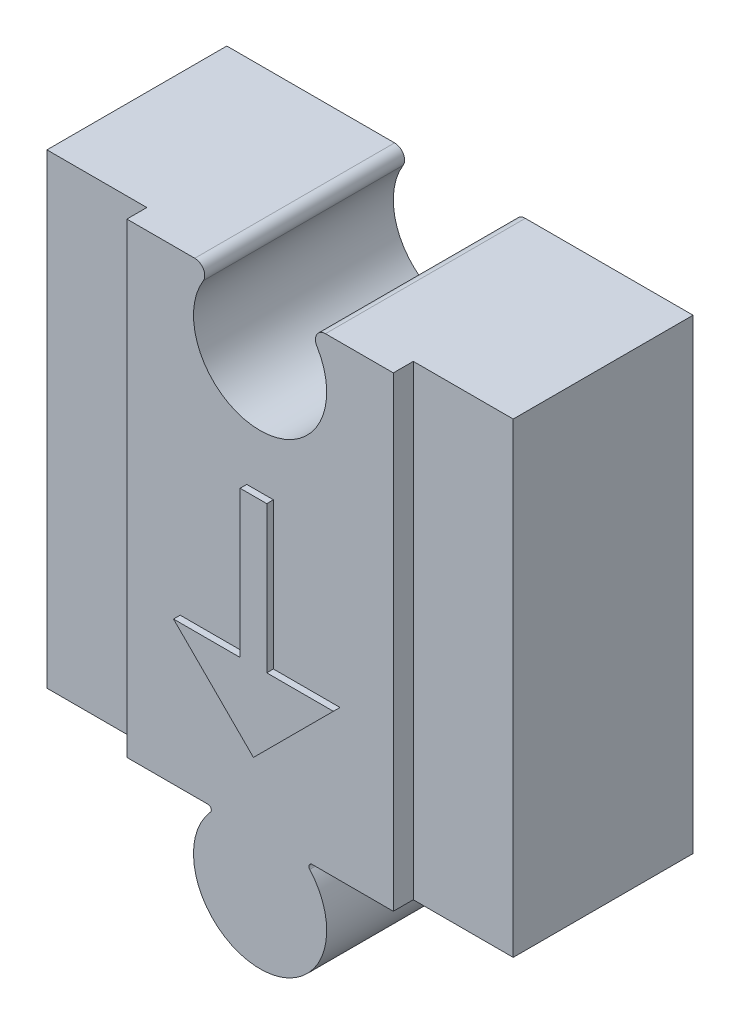
from build123d import *

# Parameters (mm, degrees)
BOSS_EXTRU_1_DEPTH           = 30
BOSS_EXTRU_2_DEPTH           = 1
ENL_V_MAT_EXTRU_2_DEPTH      = 70.865943062
ENL_V_MAT_EXTRU_2_DEPTH_BACK = 3
ENL_V_MAT_EXTRU_3_DEPTH      = 70.865943062
ENL_V_MAT_EXTRU_3_DEPTH_BACK = 3
COQUE3_OUTLINE_R             = 7
COQUE3_DEPTH                 = 24
COQUE3_START                 = 24
COQUE3_2_OUTLINE_R           = 7
COQUE3_2_DEPTH               = 3
COQUE3_START_2               = 27
COQUE3_3_DEPTH               = 1
CONG_1_R                     = 0.5
CONG_2_R                     = 1.5


# Read off the part's stored shape, not the designer's step: Coque3
with BuildPart() as part:
    # Esquisse1 → Boss.-Extru.1 (new body)
    with BuildSketch(Plane.XY):
        with BuildLine():
            Line((-35, -35), (-6.614378278, -35))
            ThreePointArc((-6.614378278, -35), (0, -52.5), (6.614378278, -35))
            Line((6.614378278, -35), (35, -35))
            Line((35, -35), (35, 35))
            Line((35, 35), (6.614378278, 35))
            ThreePointArc((6.614378278, 35), (0, 17.5), (-6.614378278, 35))
            Line((-6.614378278, 35), (-35, 35))
            Line((-35, 35), (-35, -35))
        make_face()
    extrude(amount=BOSS_EXTRU_1_DEPTH)

    # Esquisse4 → Boss.-Extru.2 (add)
    with BuildSketch(Plane.XY.offset(30)):
        Polygon((0, -24.5), (-12, -12.5), (-2, -12.5), (-2, 9.5), (2, 9.5), (2, -12.5), (12, -12.5), align=None)
    extrude(amount=BOSS_EXTRU_2_DEPTH)

    # Esquisse5 → Enlèv. mat.-Extru.2 (cut, two sides: drawn at the far end of the back side and taken through both)
    with BuildSketch(Plane.XY.offset(30).offset(-ENL_V_MAT_EXTRU_2_DEPTH_BACK)):
        Polygon((20, 251.700266086), (20, 35), (20, -35), (20, -251.700266086), (453.400532172, -251.700266086), (453.400532172, 251.700266086), align=None)
    extrude(amount=ENL_V_MAT_EXTRU_2_DEPTH + ENL_V_MAT_EXTRU_2_DEPTH_BACK, mode=Mode.SUBTRACT)

    # Esquisse6 → Enlèv. mat.-Extru.3 (cut, two sides: drawn at the far end of the back side and taken through both)
    with BuildSketch(Plane.XY.offset(30).offset(-ENL_V_MAT_EXTRU_3_DEPTH_BACK)):
        Polygon((-20, 251.700266086), (-20, 35), (-20, -35), (-20, -251.700266086), (-453.400532172, -251.700266086), (-453.400532172, 251.700266086), align=None)
    extrude(amount=ENL_V_MAT_EXTRU_3_DEPTH + ENL_V_MAT_EXTRU_3_DEPTH_BACK, mode=Mode.SUBTRACT)

    # Coque3 outline → Coque3 (cut)
    with BuildSketch(Plane.XY):
        with Locations((0, -42.5)):
            Circle(COQUE3_OUTLINE_R)
        with BuildLine():
            Line((-32, -32), (32, -32))
            Line((32, -32), (32, 32))
            Line((32, 32), (12.196310918, 32))
            ThreePointArc((12.196310918, 32), (0, 14.5), (-12.196310918, 32))
            Line((-12.196310918, 32), (-32, 32))
            Line((-32, 32), (-32, -32))
        make_face()
    extrude(amount=COQUE3_DEPTH, mode=Mode.SUBTRACT)

    # Coque3 2 outline → Coque3 2 (cut)
    with BuildSketch(Plane.XY.offset(COQUE3_START)):
        with Locations((0, -42.5)):
            Circle(COQUE3_2_OUTLINE_R)
        with BuildLine():
            Line((-17, 32), (-17, -32))
            Line((-17, -32), (17, -32))
            Line((17, -32), (17, 32))
            Line((17, 32), (12.196310918, 32))
            ThreePointArc((12.196310918, 32), (0, 14.5), (-12.196310918, 32))
            Line((-12.196310918, 32), (-17, 32))
        make_face()
    extrude(amount=COQUE3_2_DEPTH, mode=Mode.SUBTRACT)

    # Coque3 3 outline → Coque3 3 (cut)
    with BuildSketch(Plane.XY.offset(COQUE3_START_2)):
        Polygon((4.757359313, -15.5), (-4.757359313, -15.5), (0, -20.257359313), align=None)
    extrude(amount=COQUE3_3_DEPTH, mode=Mode.SUBTRACT)

    # Congé1
    cong_1_edges = [part.edges().sort_by_distance(p)[0] for p in [
        (6.614378278, -35, 15),
        (-6.614378278, -35, 15),
    ]]
    fillet(cong_1_edges, radius=CONG_1_R)

    # Congé2
    cong_2_edges = [part.edges().sort_by_distance(p)[0] for p in [
        (-6.614378278, 35, 15),
        (6.614378278, 35, 15),
    ]]
    fillet(cong_2_edges, radius=CONG_2_R)


solid = part.part
